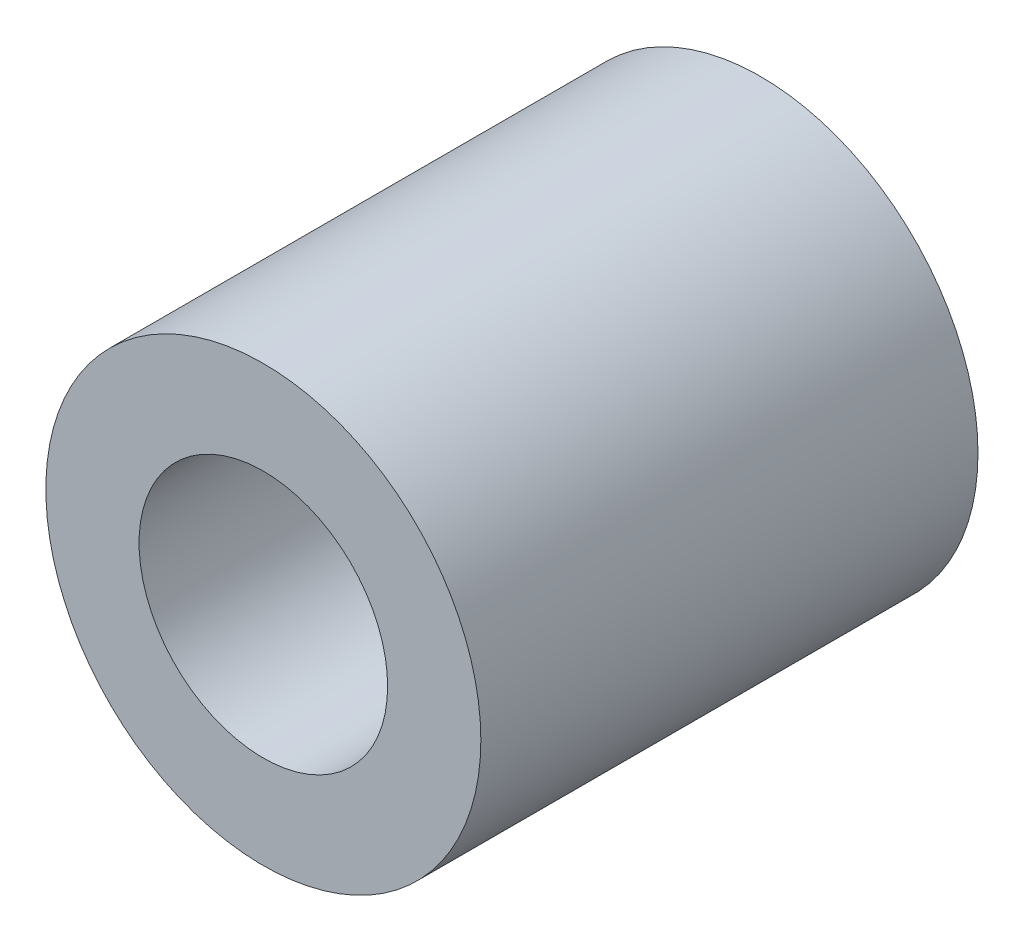
from build123d import *

# Parameters (mm, degrees)
SKETCH1_R           = 7
SKETCH1_R_2         = 4
BOSS_EXTRUDE1_DEPTH = 16


with BuildPart() as part:
    # Sketch1 → Boss-Extrude1 (new body)
    with BuildSketch(Plane.XY):
        Circle(SKETCH1_R)
        Circle(SKETCH1_R_2, mode=Mode.SUBTRACT)
    extrude(amount=BOSS_EXTRUDE1_DEPTH)


solid = part.part
